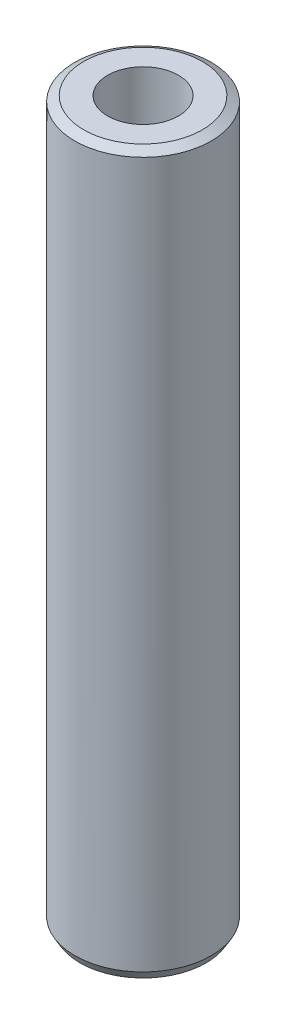
from build123d import *
from OCP.BRepFilletAPI import BRepFilletAPI_MakeChamfer

# Parameters (mm, degrees)
SKETCH1_R           = 37.5
BOSS_EXTRUDE1_DEPTH = 395.585591635
SKETCH2_R           = 19.455620619
CUT_EXTRUDE1_DEPTH  = 400.124617519
CHAMFER1_SIZE       = 2.860767771
CHAMFER1_SIZE2      = 4.901579284


with BuildPart() as part:
    # Sketch1 → Boss-Extrude1 (new body)
    with BuildSketch(Plane(origin=(0, 0, 0), x_dir=(1, 0, 0), z_dir=(0, 1, 0))):
        Circle(SKETCH1_R)
    extrude(amount=BOSS_EXTRUDE1_DEPTH)

    # Sketch2 → Cut-Extrude1 (cut, through all)
    with BuildSketch(Plane(origin=(0, 0, 0), x_dir=(1, 0, 0), z_dir=(0, 1, 0))):
        Circle(SKETCH2_R)
    extrude(amount=CUT_EXTRUDE1_DEPTH, mode=Mode.SUBTRACT)

    # Chamfer1: one chamfer whose edges measure the first distance from different faces: ONE call of the kernel's chamfer builder (chamfer() names one face for all edges)
    chamfer1_edges_1 = [part.edges().sort_by_distance(p)[0] for p in [
        (-37.5, 395.585591635, 0),
    ]]
    chamfer1_side_1 = [part.faces().sort_by_distance(p)[0] for p in [
        (-37.5, 197.792795818, 0),
    ]]
    chamfer1_edges_2 = [part.edges().sort_by_distance(p)[0] for p in [
        (-37.5, 0, 0),
    ]]
    chamfer1_side_2 = [part.faces().sort_by_distance(p)[0] for p in [
        (-36.439339828, 0, 0),
    ]]
    chamfer1 = BRepFilletAPI_MakeChamfer(part.part.solid().wrapped)
    for e in chamfer1_edges_1:
        chamfer1.Add(CHAMFER1_SIZE, CHAMFER1_SIZE2, e.wrapped, chamfer1_side_1[0].wrapped)  # the first distance lies on this face
    for e in chamfer1_edges_2:
        chamfer1.Add(CHAMFER1_SIZE, CHAMFER1_SIZE2, e.wrapped, chamfer1_side_2[0].wrapped)  # the first distance lies on this face
    add(Compound.cast(chamfer1.Shape()), mode=Mode.REPLACE)


solid = part.part
